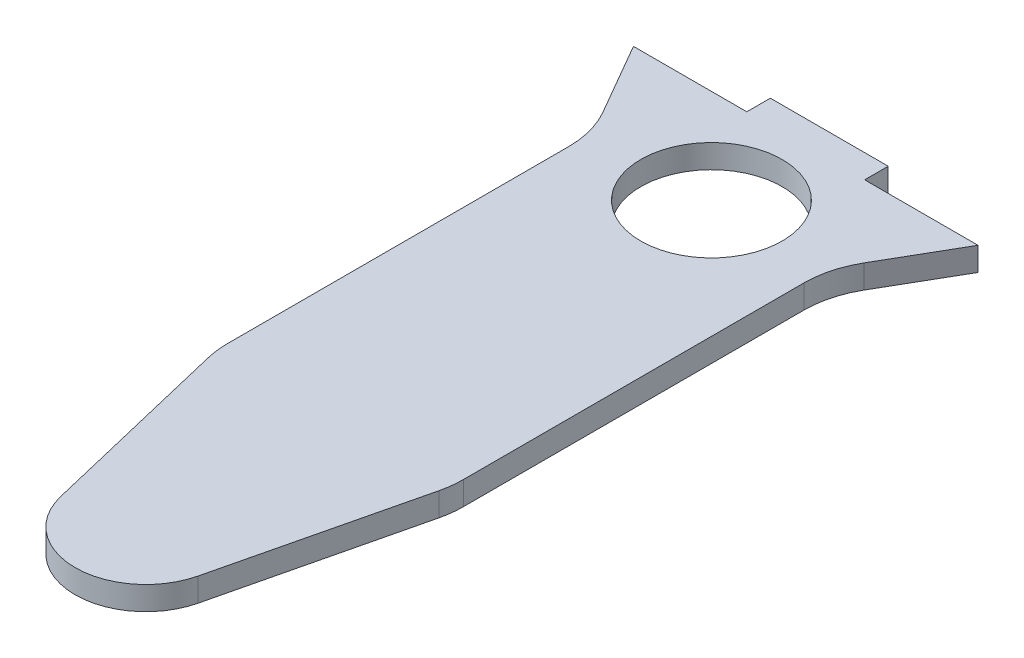
from build123d import *

# Parameters (mm, degrees)
SKETCH2_R           = 19.05
BOSS_EXTRUDE1_DEPTH = 6.35
FILLET1_R           = 25.4


with BuildPart() as part:
    # Sketch2 → Boss-Extrude1 (new body)
    with BuildSketch(Plane(origin=(0, 69.85, 0), x_dir=(1, 0, 0), z_dir=(0, 1, 0))):
        with BuildLine():
            Line((-15.875, 6.35), (15.875, 6.35))
            Line((15.875, 6.35), (15.875, 0))
            Line((15.875, 0), (46.414696837, 0))
            Line((46.414696837, 0), (35.152954744, -19.505909488))
            ThreePointArc((35.152954744, -19.505909488), (32.615484012, -25.631905742), (31.75, -32.205909488))
            Line((31.75, -32.205909488), (31.75, -127))
            Line((31.75, -127), (18.526483585, -182.235302241))
            ThreePointArc((18.526483585, -182.235302241), (0, -196.85), (-18.526483585, -182.235302241))
            Line((-18.526483585, -182.235302241), (-31.75, -127))
            Line((-31.75, -127), (-31.75, -32.205909488))
            ThreePointArc((-31.75, -32.205909488), (-32.615484012, -25.631905742), (-35.152954744, -19.505909488))
            Line((-35.152954744, -19.505909488), (-46.414696837, 0))
            Line((-46.414696837, 0), (-15.875, 0))
            Line((-15.875, 0), (-15.875, 6.35))
        make_face()
        with Locations((0, -25.4)):
            Circle(SKETCH2_R, mode=Mode.SUBTRACT)
    extrude(amount=BOSS_EXTRUDE1_DEPTH)

    # Fillet1
    fillet1_edges = [part.edges().sort_by_distance(p)[0] for p in [
        (31.75, 73.025, 127),
        (-31.75, 73.025, 127),
    ]]
    fillet(fillet1_edges, radius=FILLET1_R)


solid = part.part
